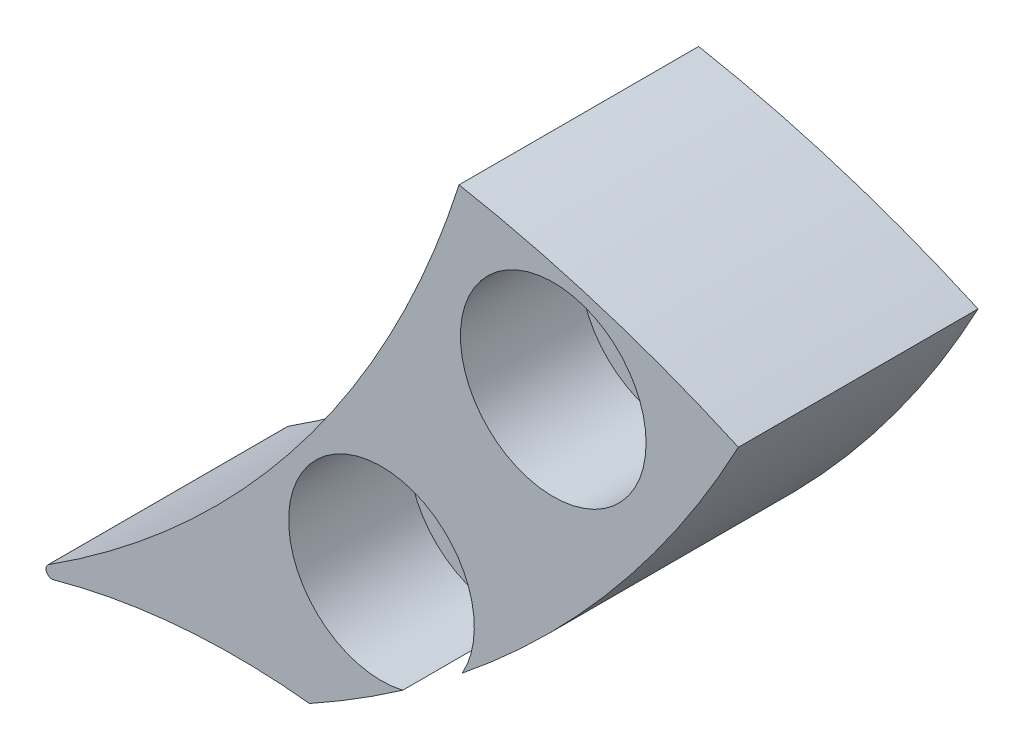
from build123d import *

# Parameters (mm, degrees)
SKETCH_1_R          = 1.75
EXTRUDE_1_DEPTH     = 8
SKETCH_2_R          = 3.1
CUT_EXTRUDE_1_DEPTH = 4


with BuildPart() as part:
    # 草图1 → 凸台-拉伸1 (new body)
    with BuildSketch(Plane.XY):
        with BuildLine():
            ThreePointArc((17.752960213, -27.817843261), (26.168462783, -20.105013195), (31.452678549, -9.986441414))
            ThreePointArc((31.452678549, -9.986441414), (36.204699363, -11.168196632), (40.780918022, -12.910743617))
            ThreePointArc((40.780918022, -12.910743617), (34.675351408, -21.234427477), (26.458667523, -27.483248376))
            ThreePointArc((26.458667523, -27.483248376), (22.153286402, -27.425076651), (17.91405671, -28.179147045))
            ThreePointArc((17.91405671, -28.179147045), (17.677888746, -28.067882167), (17.752960213, -27.817843261))
        make_face()
        with Locations((34.597913338, -14.333862473)):
            Circle(SKETCH_1_R, mode=Mode.SUBTRACT)
        with Locations((28.862148975, -22.525382916)):
            Circle(SKETCH_1_R, mode=Mode.SUBTRACT)
    extrude(amount=EXTRUDE_1_DEPTH)

    # 草图2 → 切除-拉伸1 (cut)
    with BuildSketch(Plane.XY.offset(8)):
        with Locations((28.862148975, -22.525382916)):
            Circle(SKETCH_2_R)
        with Locations((34.597913338, -14.333862473)):
            Circle(SKETCH_2_R)
    extrude(amount=-CUT_EXTRUDE_1_DEPTH, mode=Mode.SUBTRACT)


solid = part.part
